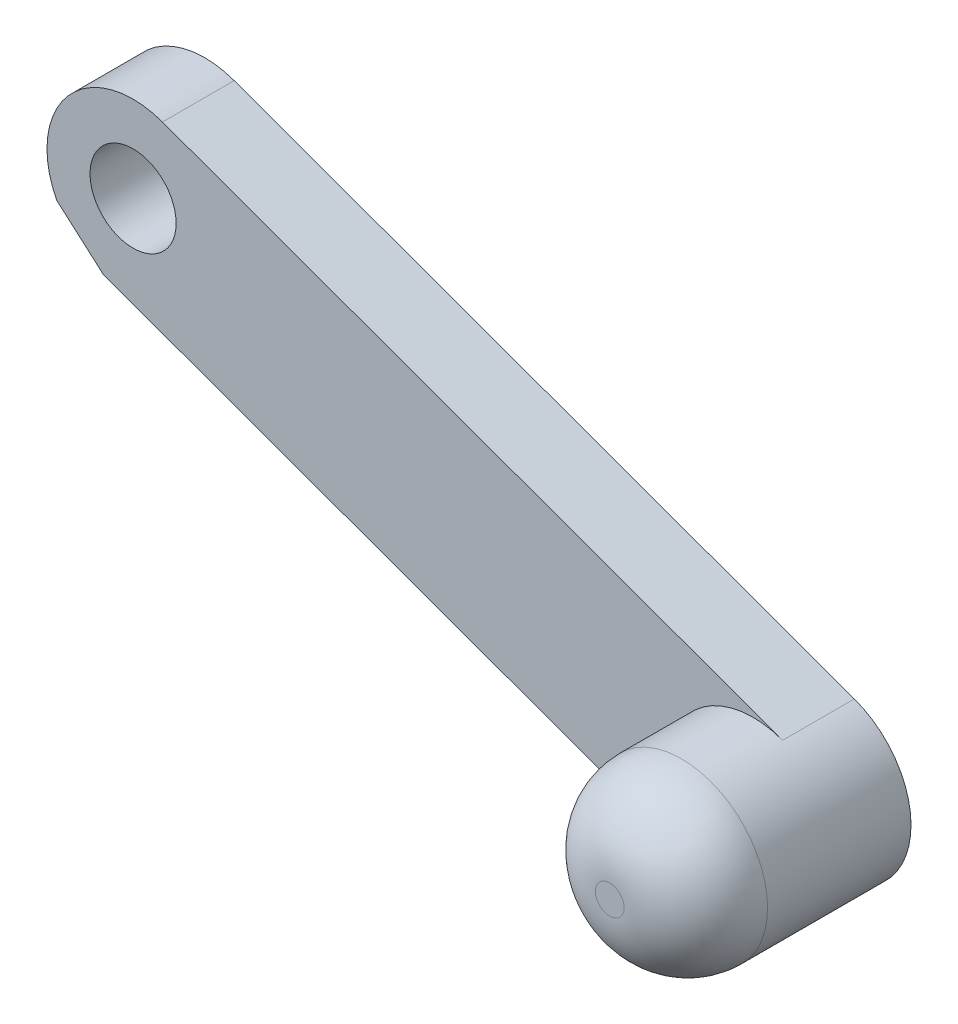
from build123d import *

# Parameters (mm, degrees)
CROQUIS1_R              = 1.5
CROQUIS1_R_2            = 0.901496021
SALIENTE_EXTRUIR1_DEPTH = 2.5
CROQUIS2_R              = 3
SALIENTE_EXTRUIR2_DEPTH = 5
REDONDEO1_R             = 2.5


with BuildPart() as part:
    # Croquis1 → Saliente-Extruir1 (new body)
    with BuildSketch(Plane.XY.offset(-107.5)):
        with BuildLine():
            Line((163.042186646, -39.002916794), (154.076371743, -35.744978316))
            ThreePointArc((154.076371743, -35.744978316), (150.794254841, -36.588868647), (150.392873293, -39.953885006))
            Line((150.392873293, -39.953885006), (152.021065929, -41.381969984))
            ThreePointArc((152.021065929, -41.381969984), (152.024143971, -41.383094175), (152.02722324, -41.384215004))
            Line((152.02722324, -41.384215004), (173.644297207, -49.239284265))
            ThreePointArc((173.644297207, -49.239284265), (177.488489802, -47.444240173), (175.69344571, -43.600047578))
            Line((175.69344571, -43.600047578), (163.042186646, -39.002916794))
        make_face()
        with Locations((153.051797491, -38.56459666)):
            Circle(CROQUIS1_R, mode=Mode.SUBTRACT)
        with Locations((174.668871458, -46.419665921)):
            Circle(CROQUIS1_R_2, mode=Mode.SUBTRACT)
    extrude(amount=SALIENTE_EXTRUIR1_DEPTH)

    # Croquis2 → Saliente-Extruir2 (add)
    with BuildSketch(Plane.XY.offset(-105)):
        with Locations((174.668871458, -46.419665921)):
            Circle(CROQUIS2_R)
    extrude(amount=SALIENTE_EXTRUIR2_DEPTH)

    # Redondeo1
    redondeo1_edges = [part.edges().sort_by_distance(p)[0] for p in [
        (171.668871458, -46.419665921, -100),
    ]]
    fillet(redondeo1_edges, radius=REDONDEO1_R)


solid = part.part
